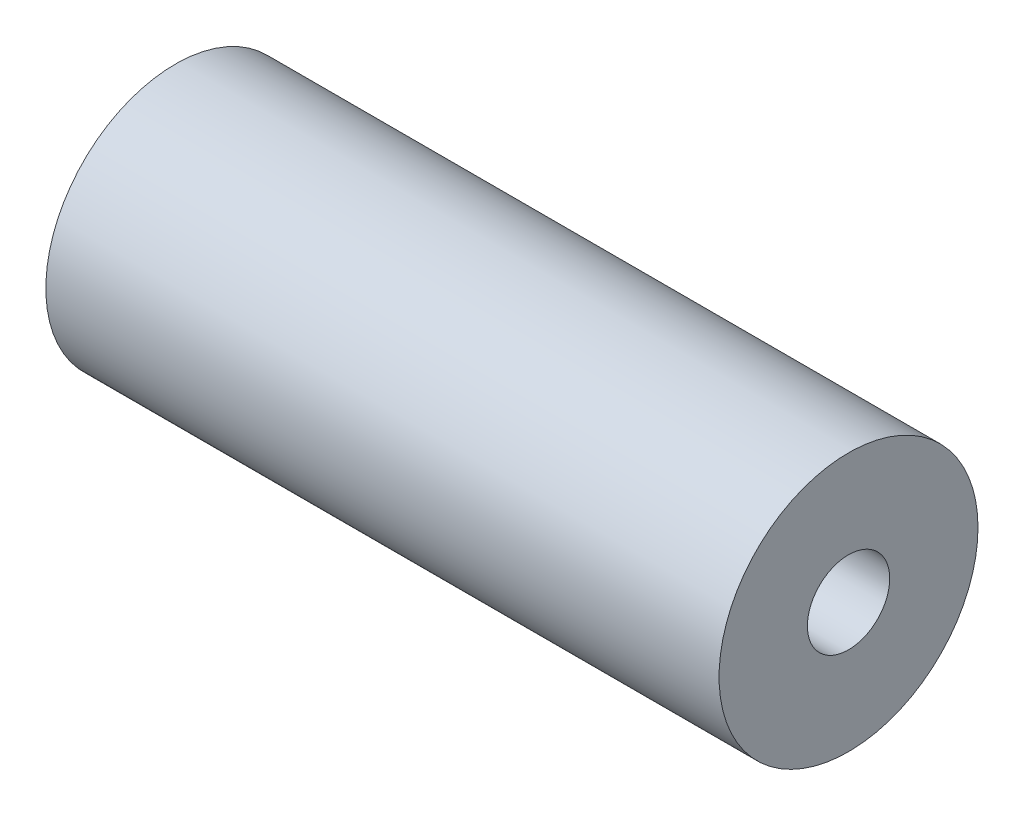
from build123d import *

# Parameters (mm, degrees)
SKETCH1_R           = 6.35
BOSS_EXTRUDE1_DEPTH = 16.51


with BuildPart() as part:
    # Sketch1 → Boss-Extrude1 (new, symmetric)
    with BuildSketch(Plane(origin=(0, 0, 0), x_dir=(0, 0, -1), z_dir=(1, 0, 0))):
        Circle(SKETCH1_R)
    extrude(amount=BOSS_EXTRUDE1_DEPTH, both=True)

    # Sketch3 → Tap Drill for #10-32 Tap1 (revolve, cut)
    with BuildSketch(Plane(origin=(16.51, 0, 0), x_dir=(0, 0, -1), z_dir=(0, 1, 0))):
        Polygon((0, 0), (0, 11.373317848), (2.0193, 10.16), (2.0193, 0), align=None)
    tap_drill_for_10_32_tap1 = revolve(axis=Axis((22.86, 0, 0), (-1, 0, 0)), mode=Mode.SUBTRACT)

    # Mirror1: Tap Drill for #10-32 Tap1 across plane
    add(tap_drill_for_10_32_tap1.mirror(Plane(origin=(0, 0, 0), x_dir=(0, 0, 1), z_dir=(1, 0, 0))), mode=Mode.SUBTRACT)


solid = part.part
